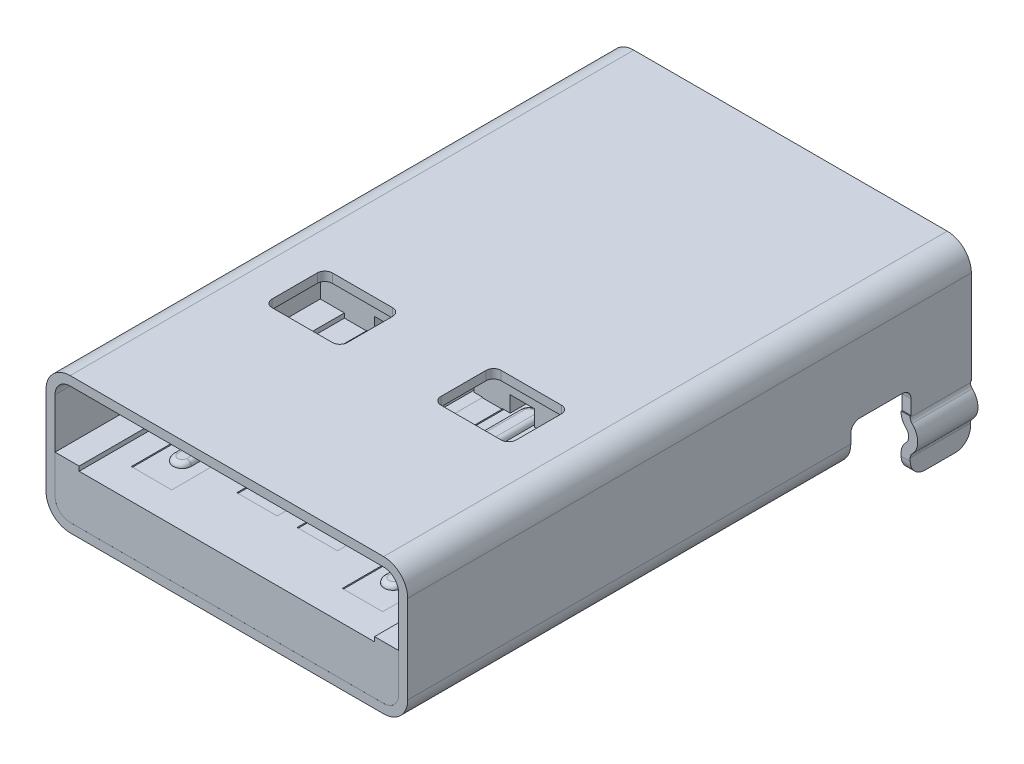
from build123d import *
from OCP.BRepFilletAPI import BRepFilletAPI_MakeFillet

# Parameters (mm, degrees)
SKETCH1_W                       = 12
SKETCH1_H                       = 18.7
BASE_DEPTH                      = 4.52
CORNER_FILLETS_R                = 0.8
CONTACT_AREA_CUTOUT_DEPTH       = 8.8
TERMINAL_HOUSING_DEPTH          = 8.8
TERMINAL_START                  = -13.4274052
TERMINAL_CUTS_DEPTH             = 21.2274052
SKETCH20_W                      = 1.34
SKETCH20_H                      = 0.24
INSIDE_TERM_ADDER_DEPTH         = 1
SKETCH21_W                      = 1.3
SKETCH21_H                      = 17.66
SKETCH21_H_2                    = 16.66
TERMINAL_DEPTH                  = 0.22
TERMINAL_CONTACT_BUMP_DEPTH     = 0.15
TCB_FILLET_R                    = 0.15
TCB_FILLET_OF_TERMINAL_MIRROR_R = 0.15
BACK_CUT_DEPTH                  = 4
BACK_START                      = -5
BACK_END_CUT_DEPTH              = 5
BACK_START_2                    = 5
BACK_PLASTIC_DEPTH              = 5
BACK_PLASTIC_CUT_DEPTH          = 4
BACK_TERMINAL_CUT_DEPTH         = 3
SKETCH30_R                      = 0.5
A_PINS_DEPTH                    = 0.9
A_DOME_FACE_RADIUS              = 0.5
A_DOME_HEIGHT                   = 0.5
A_MIRROR_COPY_1_FACE_RADIUS     = 0.5
A_MIRROR_COPY_1_HEIGHT          = 0.5
SKETCH31_W                      = 0.3
SKETCH31_H                      = 2
STEPS_FOR_GT_DEPTH              = 0.78
GROUND_TAIL_DEPTH               = 1
FILLET2_R1                      = 0.3
FILLET2_R2                      = 0.5
CUT_EXTRUDE6_DEPTH              = 0.78
CUT_EXTRUDE7_DEPTH              = 0.3
TAIL_TH_DEPTH                   = 0.3
TAIL_TH_PATTERN_COUNT           = 2
TAIL_TH_PATTERN_PITCH           = 2.5
TAIL_TH_MIRROR_COPY_1_DEPTH     = 0.3


with BuildPart() as part:
    # Sketch1 → Base (new body)
    with BuildSketch(Plane(origin=(0, 0, 0), x_dir=(1, 0, 0), z_dir=(0, 1, 0))):
        Rectangle(SKETCH1_W, SKETCH1_H)
    extrude(amount=BASE_DEPTH)

    # Corner Fillets
    corner_fillets_edges = [part.edges().sort_by_distance(p)[0] for p in [
        (6, 4.52, 0),
        (-6, 4.52, 0),
        (6, 0, 0),
        (-6, 0, 0),
    ]]
    fillet(corner_fillets_edges, radius=CORNER_FILLETS_R)

    # Sketch8 → Contact Area Cutout (cut)
    with BuildSketch(Plane.XY.offset(9.35)):
        with BuildLine():
            Line((5.2, 4.22), (-5.2, 4.22))
            ThreePointArc((-5.2, 4.22), (-5.553553391, 4.073553391), (-5.7, 3.72))
            Line((-5.7, 3.72), (-5.7, 0.8))
            ThreePointArc((-5.7, 0.8), (-5.553553391, 0.446446609), (-5.2, 0.3))
            Line((-5.2, 0.3), (5.2, 0.3))
            ThreePointArc((5.2, 0.3), (5.553553391, 0.446446609), (5.7, 0.8))
            Line((5.7, 0.8), (5.7, 3.72))
            ThreePointArc((5.7, 3.72), (5.553553391, 4.073553391), (5.2, 4.22))
        make_face()
    extrude(amount=-CONTACT_AREA_CUTOUT_DEPTH, mode=Mode.SUBTRACT)

    # Sketch16 → Terminal Housing (add)
    with BuildSketch(Plane.XY.offset(0.55)):
        with BuildLine():
            Line((-5.6995, 2.07), (-4.9, 2.07))
            Line((-4.9, 2.07), (-4.9, 1.92))
            Line((-4.9, 1.92), (4.9, 1.92))
            Line((4.9, 1.92), (4.9, 2.07))
            Line((4.9, 2.07), (5.6995, 2.07))
            Line((5.6995, 2.07), (5.6995, 0.8))
            ThreePointArc((5.6995, 0.8), (5.553199837, 0.446800163), (5.2, 0.3005))
            Line((5.2, 0.3005), (-5.2, 0.3005))
            ThreePointArc((-5.2, 0.3005), (-5.553199837, 0.446800163), (-5.6995, 0.8))
            Line((-5.6995, 0.8), (-5.6995, 2.07))
        make_face()
    extrude(amount=TERMINAL_HOUSING_DEPTH)

    # Sketch19 → Terminal Cuts (cut)
    with BuildSketch(Plane.XY.offset(0.55).offset(TERMINAL_START)):
        Polygon((-4.17, 1.94), (-3.9, 1.94), (-3.9, 2.47), (-3.1, 2.47), (-3.1, 1.94), (-2.83, 1.94), (-2.83, 1.68), (-4.17, 1.68), align=None)
        Polygon((-1.4, 1.94), (-1.67, 1.94), (-1.67, 1.68), (-0.33, 1.68), (-0.33, 1.94), (-0.6, 1.94), (-0.6, 2.47), (-1.4, 2.47), align=None)
    terminal_cuts = extrude(amount=TERMINAL_CUTS_DEPTH, mode=Mode.SUBTRACT)

    # Sketch20 → Inside Term Adder (add)
    with BuildSketch(Plane(origin=(0, 0, 8.35), x_dir=(-1, 0, 0), z_dir=(0, 0, -1))):
        with Locations((1, 1.8)):
            Rectangle(SKETCH20_W, SKETCH20_H)
    inside_term_adder = extrude(amount=INSIDE_TERM_ADDER_DEPTH)

    # Terminal Cuts Mirror: Terminal Cuts, Inside Term Adder across plane
    add(terminal_cuts.mirror(Plane(origin=(0, 0, 0), x_dir=(0, 0, 1), z_dir=(1, 0, 0))), mode=Mode.SUBTRACT)
    add(inside_term_adder.mirror(Plane(origin=(0, 0, 0), x_dir=(0, 0, 1), z_dir=(1, 0, 0))))

    # Sketch21 → Terminal (add)
    with BuildSketch(Plane(origin=(0, 1.68, 0), x_dir=(-1, 0, 0), z_dir=(0, 1, 0))):
        with Locations((3.5, -0.5)):
            Rectangle(SKETCH21_W, SKETCH21_H)
        with Locations((1, -1)):
            Rectangle(SKETCH21_W, SKETCH21_H_2)
    terminal = extrude(amount=TERMINAL_DEPTH)

    # Sketch22 → Terminal Contact Bump (add)
    with BuildSketch(Plane(origin=(0, 1.9, 0), x_dir=(-1, 0, 0), z_dir=(0, 1, 0))):
        with BuildLine():
            Line((3.8, 0.33), (3.8, 7.33))
            ThreePointArc((3.8, 7.33), (3.5, 7.63), (3.2, 7.33))
            Line((3.2, 7.33), (3.2, 0.33))
            ThreePointArc((3.2, 0.33), (3.5, 0.03), (3.8, 0.33))
        make_face()
        with BuildLine():
            Line((1.3, 0.33), (1.3, 6.33))
            ThreePointArc((1.3, 6.33), (1, 6.63), (0.7, 6.33))
            Line((0.7, 6.33), (0.7, 0.33))
            ThreePointArc((0.7, 0.33), (1, 0.03), (1.3, 0.33))
        make_face()
    terminal_contact_bump = extrude(amount=TERMINAL_CONTACT_BUMP_DEPTH)

    # TCB Fillet
    tcb_fillet_edges = [part.edges().sort_by_distance(p)[0] for p in [
        (-3.8, 2.05, 3.83),
        (-3.5, 2.05, 0.03),
        (-3.2, 2.05, 3.83),
        (-3.5, 2.05, 7.63),
        (-1.3, 2.05, 3.33),
        (-1, 2.05, 0.03),
        (-0.7, 2.05, 3.33),
        (-1, 2.05, 6.63),
    ]]
    fillet(tcb_fillet_edges, radius=TCB_FILLET_R - 0.0001)  # a hair under: the kernel refuses the full size

    # Terminal Mirror: Terminal, Terminal Contact Bump across plane
    add(terminal.mirror(Plane(origin=(0, 0, 0), x_dir=(0, 0, 1), z_dir=(1, 0, 0))))
    add(terminal_contact_bump.mirror(Plane(origin=(0, 0, 0), x_dir=(0, 0, 1), z_dir=(1, 0, 0))))

    # TCB Fillet of Terminal Mirror
    tcb_fillet_of_terminal_mirror_edges = [part.edges().sort_by_distance(p)[0] for p in [
        (3.8, 2.05, 3.83),
        (3.5, 2.05, 0.03),
        (3.2, 2.05, 3.83),
        (3.5, 2.05, 7.63),
        (1.3, 2.05, 3.33),
        (1, 2.05, 0.03),
        (0.7, 2.05, 3.33),
        (1, 2.05, 6.63),
    ]]
    fillet(tcb_fillet_of_terminal_mirror_edges, radius=TCB_FILLET_OF_TERMINAL_MIRROR_R - 0.0001)  # a hair under: the kernel refuses the full size

    # Sketch24 → Back Cut (cut)
    with BuildSketch(Plane(origin=(0, 0, -9.35), x_dir=(-1, 0, 0), z_dir=(0, 0, -1))):
        with BuildLine():
            Line((6, 1.4), (6, 0.8))
            ThreePointArc((6, 0.8), (5.765685425, 0.234314575), (5.2, 0))
            Line((5.2, 0), (-5.2, 0))
            ThreePointArc((-5.2, 0), (-5.765685425, 0.234314575), (-6, 0.8))
            Line((-6, 0.8), (-6, 1.4))
            Line((-6, 1.4), (6, 1.4))
        make_face()
    extrude(amount=-BACK_CUT_DEPTH, mode=Mode.SUBTRACT)

    # Sketch25 → Back End Cut (cut)
    with BuildSketch(Plane(origin=(0, 0, -9.35), x_dir=(-1, 0, 0), z_dir=(0, 0, -1)).offset(BACK_START)):
        with BuildLine():
            Line((5.7, 0.8), (5.7, 3.72))
            ThreePointArc((5.7, 3.72), (5.553553391, 4.073553391), (5.2, 4.22))
            Line((5.2, 4.22), (-5.2, 4.22))
            ThreePointArc((-5.2, 4.22), (-5.553553391, 4.073553391), (-5.7, 3.72))
            Line((-5.7, 3.72), (-5.7, 0.8))
            ThreePointArc((-5.7, 0.8), (-5.553553391, 0.446446609), (-5.2, 0.3))
            Line((-5.2, 0.3), (5.2, 0.3))
            ThreePointArc((5.2, 0.3), (5.553553391, 0.446446609), (5.7, 0.8))
        make_face()
    extrude(amount=BACK_END_CUT_DEPTH, mode=Mode.SUBTRACT)

    # Sketch26 → Back Plastic (add)
    with BuildSketch(Plane(origin=(0, 0, -4.35), x_dir=(-1, 0, 0), z_dir=(0, 0, -1)).offset(BACK_START_2)):
        with BuildLine():
            Line((5.6995, 0.8), (5.6995, 3.72))
            ThreePointArc((5.6995, 3.72), (5.553199837, 4.073199837), (5.2, 4.2195))
            Line((5.2, 4.2195), (-5.2, 4.2195))
            ThreePointArc((-5.2, 4.2195), (-5.553199837, 4.073199837), (-5.6995, 3.72))
            Line((-5.6995, 3.72), (-5.6995, 0.8))
            ThreePointArc((-5.6995, 0.8), (-5.553199837, 0.446800163), (-5.2, 0.3005))
            Line((-5.2, 0.3005), (5.2, 0.3005))
            ThreePointArc((5.2, 0.3005), (5.553199837, 0.446800163), (5.6995, 0.8))
        make_face()
    extrude(amount=-BACK_PLASTIC_DEPTH)

    # Sketch27 → Back Plastic Cut (cut)
    with BuildSketch(Plane(origin=(0, 0, -9.35), x_dir=(-1, 0, 0), z_dir=(0, 0, -1))):
        with BuildLine():
            Line((-5.6995, 1.4), (5.6995, 1.4))
            Line((5.6995, 1.4), (5.6995, 0.8))
            ThreePointArc((5.6995, 0.8), (5.553199837, 0.446800163), (5.2, 0.3005))
            Line((5.2, 0.3005), (-5.2, 0.3005))
            ThreePointArc((-5.2, 0.3005), (-5.553199837, 0.446800163), (-5.6995, 0.8))
            Line((-5.6995, 0.8), (-5.6995, 1.4))
        make_face()
    extrude(amount=-BACK_PLASTIC_CUT_DEPTH, mode=Mode.SUBTRACT)

    # Sketch28 → Back Terminal Cut (cut)
    with BuildSketch(Plane(origin=(0, 0, -9.35), x_dir=(-1, 0, 0), z_dir=(0, 0, -1))):
        Polygon((0.33, 1.6), (0.33, 1.94), (0.6, 1.94), (0.6, 2.5), (1.4, 2.5), (1.4, 1.94), (1.67, 1.94), (1.67, 1.6), align=None)
        Polygon((-3.1, 2.5), (-3.9, 2.5), (-3.9, 1.94), (-4.17, 1.94), (-4.17, 1.6), (-2.83, 1.6), (-2.83, 1.94), (-3.1, 1.94), align=None)
        Polygon((4.17, 1.94), (4.17, 1.6), (2.83, 1.6), (2.83, 1.94), (3.1, 1.94), (3.1, 2.5), (3.9, 2.5), (3.9, 1.94), align=None)
        Polygon((-0.6, 2.5), (-1.4, 2.5), (-1.4, 1.94), (-1.67, 1.94), (-1.67, 1.6), (-0.33, 1.6), (-0.33, 1.94), (-0.6, 1.94), align=None)
    extrude(amount=-BACK_TERMINAL_CUT_DEPTH, mode=Mode.SUBTRACT)

    # Sketch30 → -A Pins (add)
    with BuildSketch(Plane.XZ.offset(-1.4)):
        with Locations(Location((2.3, -8.32, 0), (0, 0, 90))):
            Circle(SKETCH30_R)
    a_pins = extrude(amount=A_PINS_DEPTH)

    # -A Dome: a dome of height H over a round flat face of radius A is a cap of a sphere of radius (A * A + H * H) / (2 * H)
    a_dome_r = (A_DOME_FACE_RADIUS * A_DOME_FACE_RADIUS + A_DOME_HEIGHT * A_DOME_HEIGHT) / (2 * A_DOME_HEIGHT)
    a_dome_base = Plane((2.3, 0.5, -8.32), z_dir=(0, -1, 0))
    with Locations(a_dome_base.offset(A_DOME_HEIGHT - a_dome_r)):
        a_dome_ball = Sphere(a_dome_r, mode=Mode.PRIVATE)
    add(split(a_dome_ball, bisect_by=a_dome_base, keep=Keep.TOP, mode=Mode.PRIVATE))

    # -A Mirror: -A Pins across plane
    add(a_pins.mirror(Plane(origin=(0, 0, 0), x_dir=(0, 0, 1), z_dir=(1, 0, 0))))

    # -A Mirror copy 1: a dome of height H over a round flat face of radius A is a cap of a sphere of radius (A * A + H * H) / (2 * H)
    a_mirror_copy_1_r = (A_MIRROR_COPY_1_FACE_RADIUS * A_MIRROR_COPY_1_FACE_RADIUS + A_MIRROR_COPY_1_HEIGHT * A_MIRROR_COPY_1_HEIGHT) / (2 * A_MIRROR_COPY_1_HEIGHT)
    a_mirror_copy_1_base = Plane((-2.3, 0.5, -8.32), z_dir=(0, -1, 0))
    with Locations(a_mirror_copy_1_base.offset(A_MIRROR_COPY_1_HEIGHT - a_mirror_copy_1_r)):
        a_mirror_copy_1_ball = Sphere(a_mirror_copy_1_r, mode=Mode.PRIVATE)
    add(split(a_mirror_copy_1_ball, bisect_by=a_mirror_copy_1_base, keep=Keep.TOP, mode=Mode.PRIVATE))

    # Sketch31 → Steps for GT (add)
    with BuildSketch(Plane.XZ.offset(-1.4)):
        with Locations((5.85, -8.35)):
            Rectangle(SKETCH31_W, SKETCH31_H)
        with Locations((-5.85, -8.35)):
            Rectangle(SKETCH31_W, SKETCH31_H)
    extrude(amount=STEPS_FOR_GT_DEPTH)

    # Sketch10 → Ground Tail (add, symmetric)
    with BuildSketch(Plane(origin=(0, 0, -8.32), x_dir=(-1, 0, 0), z_dir=(0, 0, -1))):
        with BuildLine():
            Line((6, 0.581895004), (6, 0.62))
            Line((6, 0.62), (5.7, 0.62))
            Line((5.7, 0.62), (5.7, 0.581895004))
            ThreePointArc((5.7, 0.581895004), (5.740720673, 0.38425265), (5.85625, 0.218802815))
            ThreePointArc((5.85625, 0.218802815), (5.95, 0.000947502), (5.85625, -0.216907811))
            ThreePointArc((5.85625, -0.216907811), (5.740720673, -0.382357646), (5.7, -0.58))
            Line((5.7, -0.58), (5.7, -1.18))
            Line((5.7, -1.18), (6, -1.18))
            Line((6, -1.18), (6, -0.58))
            ThreePointArc((6, -0.58), (6.016288269, -0.500943058), (6.0625, -0.434763125))
            ThreePointArc((6.0625, -0.434763125), (6.25, 0.000947502), (6.0625, 0.436658128))
            ThreePointArc((6.0625, 0.436658128), (6.016288269, 0.502838062), (6, 0.581895004))
        make_face()
        with BuildLine():
            Line((-6, 0.62), (-5.7, 0.62))
            Line((-5.7, 0.62), (-5.7, 0.581895004))
            ThreePointArc((-5.7, 0.581895004), (-5.740720673, 0.38425265), (-5.85625, 0.218802815))
            ThreePointArc((-5.85625, 0.218802815), (-5.95, 0.000947502), (-5.85625, -0.216907811))
            ThreePointArc((-5.85625, -0.216907811), (-5.740720673, -0.382357646), (-5.7, -0.58))
            Line((-5.7, -0.58), (-5.7, -1.18))
            Line((-5.7, -1.18), (-6, -1.18))
            Line((-6, -1.18), (-6, -0.58))
            ThreePointArc((-6, -0.58), (-6.016288269, -0.500943058), (-6.0625, -0.434763125))
            ThreePointArc((-6.0625, -0.434763125), (-6.25, 0.000947502), (-6.0625, 0.436658128))
            ThreePointArc((-6.0625, 0.436658128), (-6.016288269, 0.502838062), (-6, 0.581895004))
            Line((-6, 0.581895004), (-6, 0.62))
        make_face()
    extrude(amount=GROUND_TAIL_DEPTH, both=True)

    # Fillet2: one fillet with a radius per group of edges: ONE call of the kernel's fillet builder (fillet() takes one radius for all edges)
    fillet2_edges_1 = [part.edges().sort_by_distance(p)[0] for p in [
        (5.85, 1.4, -5.35),
        (5.85, 1.4, -7.35),
        (-5.85, 1.4, -7.35),
        (-5.85, 1.4, -5.35),
    ]]
    fillet2_edges_2 = [part.edges().sort_by_distance(p)[0] for p in [
        (-5.85, -1.18, -7.32),
        (-5.85, -1.18, -9.32),
        (5.85, -1.18, -7.32),
        (5.85, -1.18, -9.32),
    ]]
    fillet2 = BRepFilletAPI_MakeFillet(part.part.solid().wrapped)
    for e in fillet2_edges_1:
        fillet2.Add(FILLET2_R1, e.wrapped)
    for e in fillet2_edges_2:
        fillet2.Add(FILLET2_R2, e.wrapped)
    add(Compound.cast(fillet2.Shape()), mode=Mode.REPLACE)

    # Sketch32 → Cut-Extrude6 (cut)
    with BuildSketch(Plane(origin=(0, 4.52, 0), x_dir=(-1, 0, 0), z_dir=(0, 1, 0))):
        with BuildLine():
            Line((-3.8, 2.05), (-1.8, 2.05))
            ThreePointArc((-1.8, 2.05), (-1.623223305, 2.123223305), (-1.55, 2.3))
            Line((-1.55, 2.3), (-1.55, 3.8))
            ThreePointArc((-1.55, 3.8), (-1.623223305, 3.976776695), (-1.8, 4.05))
            Line((-1.8, 4.05), (-3.8, 4.05))
            ThreePointArc((-3.8, 4.05), (-3.976776695, 3.976776695), (-4.05, 3.8))
            Line((-4.05, 3.8), (-4.05, 2.3))
            ThreePointArc((-4.05, 2.3), (-3.976776695, 2.123223305), (-3.8, 2.05))
        make_face()
        with BuildLine():
            Line((1.55, 2.3), (1.55, 3.8))
            ThreePointArc((1.55, 3.8), (1.623223305, 3.976776695), (1.8, 4.05))
            Line((1.8, 4.05), (3.8, 4.05))
            ThreePointArc((3.8, 4.05), (3.976776695, 3.976776695), (4.05, 3.8))
            Line((4.05, 3.8), (4.05, 2.3))
            ThreePointArc((4.05, 2.3), (3.976776695, 2.123223305), (3.8, 2.05))
            Line((3.8, 2.05), (1.8, 2.05))
            ThreePointArc((1.8, 2.05), (1.623223305, 2.123223305), (1.55, 2.3))
        make_face()
    extrude(amount=-CUT_EXTRUDE6_DEPTH, mode=Mode.SUBTRACT)

    # Sketch33 → Cut-Extrude7 (cut)
    with BuildSketch(Plane.XZ):
        with BuildLine():
            Line((4.3, 4.05), (2.3, 4.05))
            ThreePointArc((2.3, 4.05), (2.123223305, 3.976776695), (2.05, 3.8))
            Line((2.05, 3.8), (2.05, 2.3))
            ThreePointArc((2.05, 2.3), (2.123223305, 2.123223305), (2.3, 2.05))
            Line((2.3, 2.05), (4.3, 2.05))
            ThreePointArc((4.3, 2.05), (4.476776695, 2.123223305), (4.55, 2.3))
            Line((4.55, 2.3), (4.55, 3.8))
            ThreePointArc((4.55, 3.8), (4.476776695, 3.976776695), (4.3, 4.05))
        make_face()
        with BuildLine():
            Line((-2.05, 3.8), (-2.05, 2.3))
            ThreePointArc((-2.05, 2.3), (-2.123223305, 2.123223305), (-2.3, 2.05))
            Line((-2.3, 2.05), (-4.3, 2.05))
            ThreePointArc((-4.3, 2.05), (-4.476776695, 2.123223305), (-4.55, 2.3))
            Line((-4.55, 2.3), (-4.55, 3.8))
            ThreePointArc((-4.55, 3.8), (-4.476776695, 3.976776695), (-4.3, 4.05))
            Line((-4.3, 4.05), (-2.3, 4.05))
            ThreePointArc((-2.3, 4.05), (-2.123223305, 3.976776695), (-2.05, 3.8))
        make_face()
    extrude(amount=-CUT_EXTRUDE7_DEPTH, mode=Mode.SUBTRACT)

    # Sketch34 → Tail TH (add, symmetric)
    with BuildSketch(Plane(origin=(-3.5, 0, 0), x_dir=(0, 0, -1), z_dir=(1, 0, 0))):
        with BuildLine():
            Line((10.68, 1.3), (10.68, -0.98))
            Line((10.68, -0.98), (10.38, -0.98))
            Line((10.38, -0.98), (10.38, 1.3))
            ThreePointArc((10.38, 1.3), (10.292132034, 1.512132034), (10.08, 1.6))
            Line((10.08, 1.6), (6.35, 1.6))
            Line((6.35, 1.6), (6.35, 1.9))
            Line((6.35, 1.9), (10.08, 1.9))
            ThreePointArc((10.08, 1.9), (10.504264069, 1.724264069), (10.68, 1.3))
        make_face()
    tail_th = extrude(amount=TAIL_TH_DEPTH, both=True)

    # Tail TH Pattern: Tail TH ×2
    with Locations(*[(i * TAIL_TH_PATTERN_PITCH, 0, 0) for i in range(1, TAIL_TH_PATTERN_COUNT)]):
        add(tail_th)

    # Tail TH Mirror: Tail TH across plane
    add(tail_th.mirror(Plane(origin=(0, 0, 0), x_dir=(0, 0, 1), z_dir=(1, 0, 0))))

    # Tail TH Mirror copy 1 sketch → Tail TH Mirror copy 1 (add, symmetric)
    with BuildSketch(Plane(origin=(1, 0, 0), x_dir=(0, 0, -1), z_dir=(-1, 0, 0))):
        with BuildLine():
            Line((10.68, -1.3), (10.68, 0.98))
            Line((10.68, 0.98), (10.38, 0.98))
            Line((10.38, 0.98), (10.38, -1.3))
            ThreePointArc((10.38, -1.3), (10.292132034, -1.512132034), (10.08, -1.6))
            Line((10.08, -1.6), (6.35, -1.6))
            Line((6.35, -1.6), (6.35, -1.9))
            Line((6.35, -1.9), (10.08, -1.9))
            ThreePointArc((10.08, -1.9), (10.504264069, -1.724264069), (10.68, -1.3))
        make_face()
    extrude(amount=TAIL_TH_MIRROR_COPY_1_DEPTH, both=True)


solid = part.part
